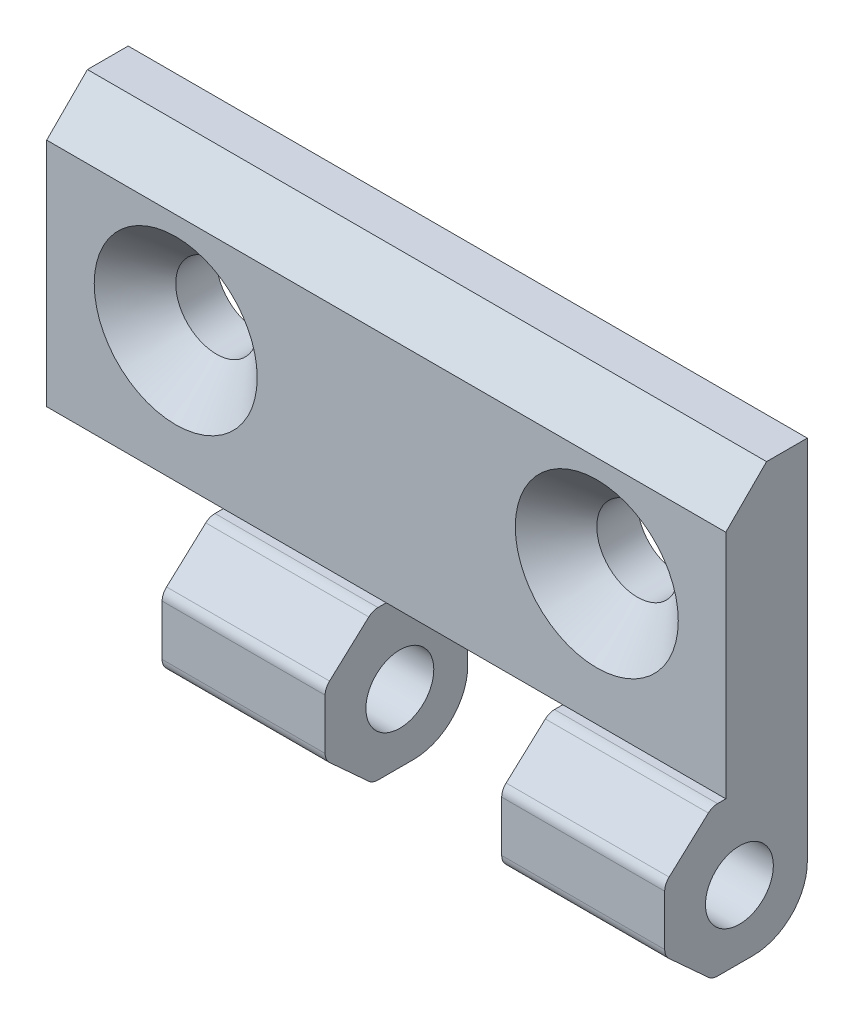
from build123d import *

# Parameters (mm, degrees)
SKETCH1_W           = 20
SKETCH1_H           = 50
BOSS_EXTRUDE1_DEPTH = 6
SKETCH2_R           = 2.5
BOSS_EXTRUDE2_DEPTH = 12
LPATTERN1_COUNT     = 2
LPATTERN1_PITCH     = 25
SKETCH3_R           = 3
CUT_EXTRUDE1_DEPTH  = 34.196385345
CHAMFER1_SIZE       = 3
CHAMFER2_SIZE       = 3


with BuildPart() as part:
    # Sketch1 → Boss-Extrude1 (new body)
    with BuildSketch(Plane(origin=(0, 0, 0), x_dir=(0, 1, 0), z_dir=(0, 0, 1))):
        Rectangle(SKETCH1_W, SKETCH1_H)
    extrude(amount=BOSS_EXTRUDE1_DEPTH)


with BuildPart() as body_2:
    # Sketch2 → Boss-Extrude2 (new body)
    with BuildSketch(Plane.YZ.offset(25)):
        with BuildLine():
            Line((-10, 0), (-17, 0))
            ThreePointArc((-17, 0), (-19.828427125, 1.171572875), (-21, 4))
            Line((-21, 4), (-21, 6.611761787))
            ThreePointArc((-21, 6.611761787), (-20.932209422, 6.973681107), (-20.738028812, 7.286530987))
            Line((-20.738028812, 7.286530987), (-18.097353875, 10.1747692))
            ThreePointArc((-18.097353875, 10.1747692), (-17.762581061, 10.415087209), (-17.359325063, 10.5))
            Line((-17.359325063, 10.5), (-13.640674937, 10.5))
            ThreePointArc((-13.640674937, 10.5), (-13.237418939, 10.415087209), (-12.902646125, 10.1747692))
            Line((-12.902646125, 10.1747692), (-10.261971188, 7.286530987))
            ThreePointArc((-10.261971188, 7.286530987), (-10.067790578, 6.973681107), (-10, 6.611761787))
            Line((-10, 6.611761787), (-10, 6))
            Line((-10, 6), (-10, 0))
        make_face()
        with Locations((-16, 5)):
            Circle(SKETCH2_R, mode=Mode.SUBTRACT)
    boss_extrude2 = extrude(amount=-BOSS_EXTRUDE2_DEPTH)


with BuildPart() as lpattern1_1:
    # LPattern1: Boss-Extrude2 ×2
    with Locations(*[(-i * LPATTERN1_PITCH, 0, 0) for i in range(1, LPATTERN1_COUNT)]):
        add(boss_extrude2)


with BuildPart() as body_2_1:
    add(body_2.part)

    # Combine1: union LPattern1_1, part
    add(lpattern1_1.part)
    add(part.part)

    # Sketch3 → Cut-Extrude1 (cut, through all)
    with BuildSketch(Plane.XY.offset(6)):
        with Locations((15.5, -0.4)):
            Circle(SKETCH3_R)
        with Locations((-15.5, -0.4)):
            Circle(SKETCH3_R)
    extrude(amount=-CUT_EXTRUDE1_DEPTH, mode=Mode.SUBTRACT)

    # Chamfer1
    chamfer1_edges = [body_2_1.edges().sort_by_distance(p)[0] for p in [
        (-18.5, -0.4, 6),
        (12.5, -0.4, 6),
    ]]
    chamfer(chamfer1_edges, length=CHAMFER1_SIZE)

    # Chamfer2
    chamfer2_edges = [body_2_1.edges().sort_by_distance(p)[0] for p in [
        (0, 10, 6),
    ]]
    chamfer(chamfer2_edges, length=CHAMFER2_SIZE)


solid = body_2_1.part
